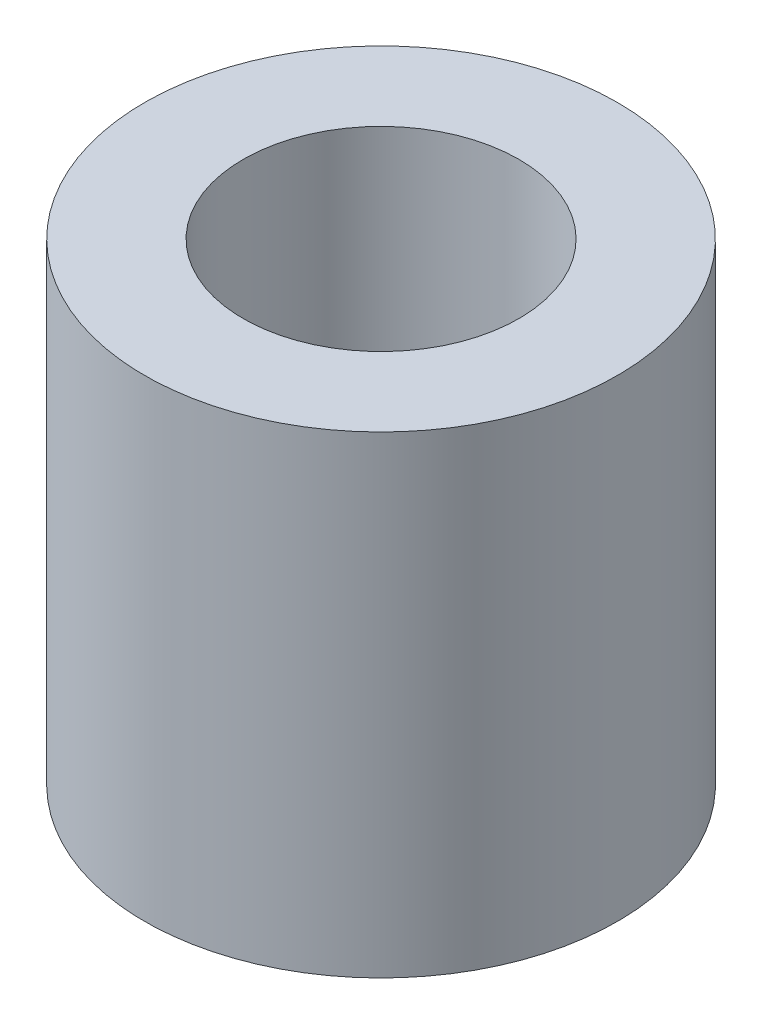
from build123d import *

# Parameters (mm, degrees)
SKETCH1_R           = 38.1
SKETCH1_R_2         = 22.225
BOSS_EXTRUDE1_DEPTH = 76.2


with BuildPart() as part:
    # Sketch1 → Boss-Extrude1 (new body)
    with BuildSketch(Plane(origin=(0, 0, 0), x_dir=(1, 0, 0), z_dir=(0, 1, 0))):
        Circle(SKETCH1_R)
        Circle(SKETCH1_R_2, mode=Mode.SUBTRACT)
    extrude(amount=BOSS_EXTRUDE1_DEPTH)


solid = part.part
